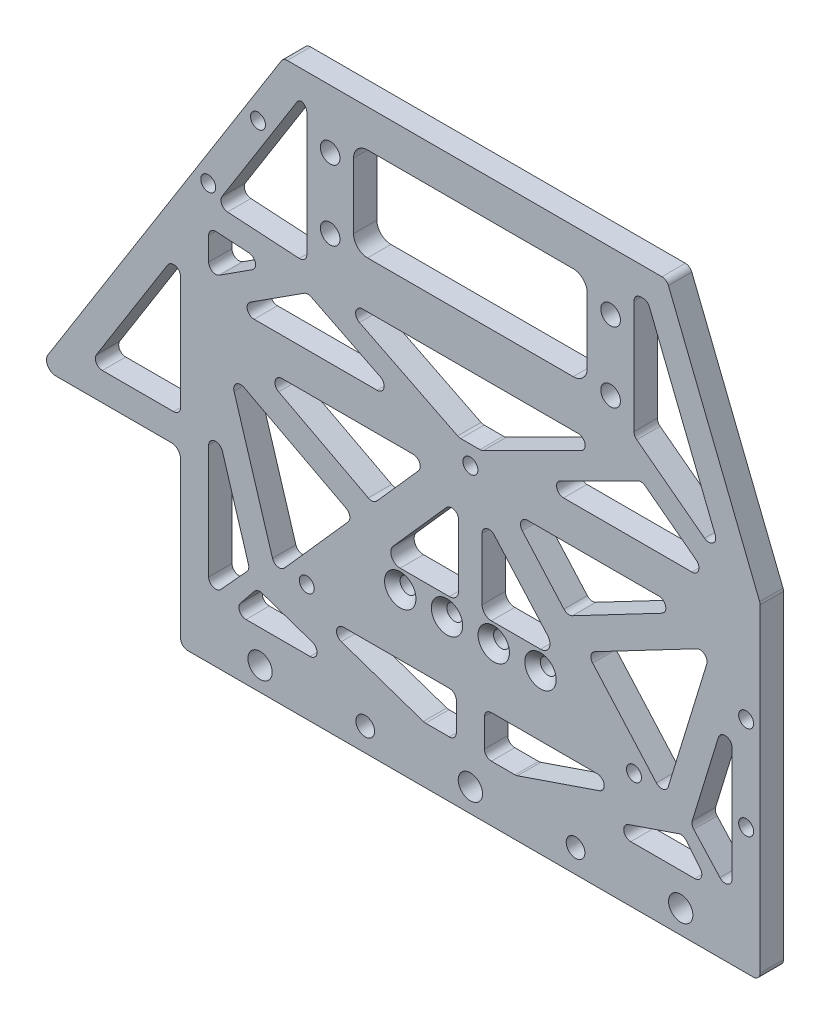
from build123d import *

# Parameters (mm, degrees)
SKETCH_1_W                   = 124
SKETCH_1_H                   = 120
EXTRUDE_1_DEPTH              = 5
SKETCH_2_R                   = 1.6
CUT_EXTRUDE_1_DEPTH          = 87.423376467
SKETCH_3_R                   = 1.6
CUT_EXTRUDE_2_DEPTH          = 87.423376467
SKETCH_4_R                   = 2.1
CUT_EXTRUDE_3_DEPTH          = 87.423376467
CHAMFER_1_SIZE               = 22
CHAMFER_1_SIZE2              = 35
CHAMFER_2_SIZE               = 50
CHAMFER_2_SIZE2              = 20
SKETCH_7_R                   = 2.6
CUT_EXTRUDE_4_DEPTH          = 87.423376467
SKETCH_8_R                   = 1.6
CUT_EXTRUDE_5_DEPTH          = 87.423376467
SKETCH_9_W                   = 50
SKETCH_9_H                   = 20
CUT_EXTRUDE_6_DEPTH          = 10
FILLET_2_R                   = 1.5
FILLET_3_R                   = 3
SKETCH_10_R                  = 2
CUT_EXTRUDE_7_DEPTH          = 10
EXTRUDE_2_DEPTH              = 5
FILLET_4_R                   = 2
SKETCH_12_R                  = 1.55
CUT_EXTRUDE_8_DEPTH          = 87.423376467
HOLE_WIZARD_M3_1_D           = 3.4
HOLE_WIZARD_M3_1_DEPTH       = 5
HOLE_WIZARD_M3_1_CSINK_D     = 6.72
HOLE_WIZARD_M3_1_CSINK_ANGLE = 90
EXTRUDE_3_DEPTH              = 5
FILLET_5_R                   = 2
CUT_EXTRUDE_9_DEPTH          = 10
FILLET_6_R                   = 1.5


with BuildPart() as part:
    # 草图1 → 凸台-拉伸1 (new body)
    with BuildSketch(Plane.XY):
        Rectangle(SKETCH_1_W, SKETCH_1_H)
    extrude(amount=EXTRUDE_1_DEPTH)

    # 草图2 → 切除-拉伸1 (cut, through all)
    with BuildSketch(Plane.XY.offset(5)):
        with Locations((-35, -35)):
            Circle(SKETCH_2_R)
        with Locations((35, -35)):
            Circle(SKETCH_2_R)
    extrude(amount=-CUT_EXTRUDE_1_DEPTH, mode=Mode.SUBTRACT)

    # 草图3 → 切除-拉伸2 (cut, through all)
    with BuildSketch(Plane.XY.offset(5)):
        with Locations((0, 4.5)):
            Circle(SKETCH_3_R)
    extrude(amount=-CUT_EXTRUDE_2_DEPTH, mode=Mode.SUBTRACT)

    # 草图4 → 切除-拉伸3 (cut, through all)
    with BuildSketch(Plane.XY.offset(5)):
        with Locations((-30, 47.5)):
            Circle(SKETCH_4_R)
        with Locations((30, 32.5)):
            Circle(SKETCH_4_R)
        with Locations((30, 47.5)):
            Circle(SKETCH_4_R)
        with Locations((-30, 32.5)):
            Circle(SKETCH_4_R)
    extrude(amount=-CUT_EXTRUDE_3_DEPTH, mode=Mode.SUBTRACT)

    # 倒角1
    chamfer_1_edges = [part.edges().sort_by_distance(p)[0] for p in [
        (-62, 60, 2.5),
    ]]
    chamfer_1_side = [part.faces().sort_by_distance(p)[0] for p in [
        (0, 60, 2.5),
    ]]
    chamfer(chamfer_1_edges, length=CHAMFER_1_SIZE, length2=CHAMFER_1_SIZE2, reference=chamfer_1_side[0])

    # 倒角2
    chamfer_2_edges = [part.edges().sort_by_distance(p)[0] for p in [
        (62, 60, 2.5),
    ]]
    chamfer_2_side = [part.faces().sort_by_distance(p)[0] for p in [
        (62, 0, 2.5),
    ]]
    chamfer(chamfer_2_edges, length=CHAMFER_2_SIZE, length2=CHAMFER_2_SIZE2, reference=chamfer_2_side[0])

    # 草图7 → 切除-拉伸4 (cut, through all)
    with BuildSketch(Plane.XY.offset(5)):
        with Locations((-45, -55)):
            Circle(SKETCH_7_R)
        with Locations((0, -55)):
            Circle(SKETCH_7_R)
        with Locations((45, -55)):
            Circle(SKETCH_7_R)
    extrude(amount=-CUT_EXTRUDE_4_DEPTH, mode=Mode.SUBTRACT)

    # 草图8 → 切除-拉伸5 (cut, through all)
    with BuildSketch(Plane(origin=(0, 0, 0), x_dir=(-1, 0, 0), z_dir=(0, 0, -1))):
        with Locations((-59, -33)):
            Circle(SKETCH_8_R)
        with Locations((-59, -13)):
            Circle(SKETCH_8_R)
        with Locations((45.442663531, 45.703937126)):
            Circle(SKETCH_8_R)
        with Locations((56.086094435, 28.771206142)):
            Circle(SKETCH_8_R)
    extrude(amount=-CUT_EXTRUDE_5_DEPTH, mode=Mode.SUBTRACT)

    # 草图9 → 切除-拉伸6 (cut)
    with BuildSketch(Plane.XY.offset(5)):
        Polygon((-20.795143669, -12.937322966), (-8.888654966, 0.5), (-46.405227211, 0.5), align=None)
        Polygon((46.405227211, 0.5), (8.888654966, 0.5), (20.795143669, -12.937322966), align=None)
        Polygon((36.651188431, 20.030509243), (13.590169944, 8.5), (51.861647432, 8.5), align=None)
        Polygon((-51.376856395, 8.5), (-13.590169944, 8.5), (-34.845181073, 19.127505564), align=None)
        Polygon((-2.409830056, 8.5), (2.409830056, 8.5), (29.409830056, 22), (-29.409830056, 22), align=None)
        with Locations((0, 42)):
            Rectangle(SKETCH_9_W, SKETCH_9_H)
        Polygon((56, -48), (56, -9.733809511), (47.224115046, -38.355523672), align=None)
        Polygon((-56, 20.766320607), (-56, 11.472020889), (-42.786156177, 19.966634775), align=None)
        Polygon((-47.224115046, -38.355523672), (-56, -9.733809511), (-56, -48), align=None)
        Polygon((-54.483388829, 25.683685076), (-35, 24.504573971), (-35, 54), (-36.684562306, 54), align=None)
        Polygon((-41.557478496, -36.369100842), (-24.893558667, -17.562677034), (-51.624213171, -3.53740308), align=None)
        Polygon((51.624213171, -3.53740308), (24.893558667, -17.562677034), (41.557478496, -36.369100842), align=None)
        Polygon((51.155461986, -48), (45.560495731, -41.070588478), (25.28565897, -48), align=None)
        Polygon((35, 27.556493075), (54.396821993, 12.852450597), (37.937802231, 54), (35, 54), align=None)
        Polygon((-25.28565897, -48), (-45.560495731, -41.070588478), (-51.155461986, -48), align=None)
        Polygon((9.825265002, -48), (36.158457982, -39), (3, -39), (3, -48), align=None)
        Polygon((-3, -39), (-36.158457982, -39), (-9.825265002, -48), (-3, -48), align=None)
        Polygon((2.5, -32), (28.333508776, -32), (2.5, -2.845040096), align=None)
        Polygon((-2.5, -32), (-2.5, -2.845040096), (-28.333508776, -32), align=None)
    extrude(amount=-CUT_EXTRUDE_6_DEPTH, mode=Mode.SUBTRACT)

    # 圆角2
    # the kernel refuses this fillet: 1.5 mm, written as the material it adds along each edge
    with BuildSketch(Plane(origin=(-20.795143669, -12.937322966, 5), x_dir=(-0.8855113060794975, 0.46461782876400964, 0), z_dir=(0, 0, -1))) as fillet_2_piece_1:
        with BuildLine():
            CenterArc((FILLET_2_R * 0.783284708727, FILLET_2_R), FILLET_2_R, 193.857889439, 76.142110561)
            Line((-FILLET_2_R * 0.187608070565, FILLET_2_R * 0.760485467833), (0, 0))
            Line((0, 0), (FILLET_2_R * 0.783284708727, 0))
        make_face()
    extrude(amount=5)
    with BuildSketch(Plane(origin=(-46.405227211, 0.5, 5), x_dir=(0.8855113060794989, -0.4646178287640068, 0), z_dir=(0, 0, -1))) as fillet_2_piece_2:
        with BuildLine():
            CenterArc((FILLET_2_R * 4.05819835002, -FILLET_2_R), FILLET_2_R, 90, 152.314508611)
            Line((FILLET_2_R * 3.59358052125, -FILLET_2_R * 1.88551130608), (0, 0))
            Line((0, 0), (FILLET_2_R * 4.05819835002, 0))
        make_face()
    extrude(amount=5)
    with BuildSketch(Plane(origin=(-8.888654966, 0.5, 5), x_dir=(-1, 0, 0), z_dir=(0, 0, -1)), Plane(origin=(-28.333508776, -32, 5), x_dir=(1, 0, 0), z_dir=(0, 0, -1)), Plane(origin=(28.333508776, -32, 5), x_dir=(-0.6631869212816371, 0.7484538111607045, 0), z_dir=(0, 0, -1)), Plane(origin=(8.888654966, 0.5, 5), x_dir=(0.663186921281637, -0.7484538111607046, 0), z_dir=(0, 0, -1))) as fillet_2_piece_3:
        with BuildLine():
            CenterArc((FILLET_2_R * 2.22216374141, -FILLET_2_R), FILLET_2_R, 90, 131.543380828)
            Line((FILLET_2_R * 1.47370993025, -FILLET_2_R * 1.66318692128), (0, 0))
            Line((0, 0), (FILLET_2_R * 2.22216374141, 0))
        make_face()
    extrude(amount=5)
    with BuildSketch(Plane(origin=(-47.224115046, -38.355523672, 5), x_dir=(-0.2931459684588604, 0.9560676969630952, 0), z_dir=(0, 0, -1)), Plane(origin=(47.224115046, -38.355523672, 5), x_dir=(0.673016151793855, -0.7396277843784607, 0), z_dir=(0, 0, -1))) as fillet_2_piece_4:
        with BuildLine():
            CenterArc((FILLET_2_R * 0.569773364902, -FILLET_2_R), FILLET_2_R, 90, 59.346676613)
            Line((-FILLET_2_R * 0.290494540513, -FILLET_2_R * 0.490157739185), (0, 0))
            Line((0, 0), (FILLET_2_R * 0.569773364902, 0))
        make_face()
    extrude(amount=5)
    with BuildSketch(Plane(origin=(-56, -48, 5), x_dir=(0.6730161517938523, 0.7396277843784631, 0), z_dir=(0, 0, -1)), Plane(origin=(56, -48, 5), x_dir=(0, 1, 0), z_dir=(0, 0, -1))) as fillet_2_piece_5:
        with BuildLine():
            CenterArc((FILLET_2_R * 2.58482323157, -FILLET_2_R), FILLET_2_R, 90, 137.699718158)
            Line((FILLET_2_R * 1.91180707978, -FILLET_2_R * 1.73962778438), (0, 0))
            Line((0, 0), (FILLET_2_R * 2.58482323157, 0))
        make_face()
    extrude(amount=5)
    with BuildSketch(Plane(origin=(-56, -9.733809511, 5), x_dir=(0.2931459684588615, -0.956067696963095, 0), z_dir=(0, 0, -1)), Plane(origin=(56, -9.733809511, 5), x_dir=(0, -1, 0), z_dir=(0, 0, -1))) as fillet_2_piece_6:
        with BuildLine():
            CenterArc((FILLET_2_R * 6.6726747335, FILLET_2_R), FILLET_2_R, 107.046394772, 162.953605228)
            Line((FILLET_2_R * 6.37952876504, FILLET_2_R * 1.95606769696), (0, 0))
            Line((0, 0), (FILLET_2_R * 6.6726747335, 0))
        make_face()
    extrude(amount=5)
    with BuildSketch(Plane(origin=(-2.5, -2.845040096, 5), x_dir=(-0.663186921281637, -0.7484538111607046, 0), z_dir=(0, 0, -1)), Plane(origin=(2.5, -2.845040096, 5), x_dir=(0, -1, 0), z_dir=(0, 0, -1))) as fillet_2_piece_7:
        with BuildLine():
            CenterArc((FILLET_2_R * 2.63644193673, -FILLET_2_R), FILLET_2_R, 90, 138.456619172)
            Line((FILLET_2_R * 1.97325501545, -FILLET_2_R * 1.74845381116), (0, 0))
            Line((0, 0), (FILLET_2_R * 2.63644193673, 0))
        make_face()
    extrude(amount=5)
    with BuildSketch(Plane(origin=(-2.5, -32, 5), x_dir=(-1, 0, 0), z_dir=(0, 0, -1)), Plane(origin=(2.5, -32, 5), x_dir=(0, 1, 0), z_dir=(0, 0, -1)), Plane(origin=(-3, -48, 5), x_dir=(-1, 0, 0), z_dir=(0, 0, -1))) as fillet_2_piece_8:
        with BuildLine():
            CenterArc((FILLET_2_R, FILLET_2_R), FILLET_2_R, 180, 90)
            Line((0, FILLET_2_R), (0, 0))
            Line((0, 0), (FILLET_2_R, 0))
        make_face()
    extrude(amount=5)
    with BuildSketch(Plane(origin=(3, -48, 5), x_dir=(1, 0, 0), z_dir=(0, 0, -1)), Plane(origin=(3, -39, 5), x_dir=(0, -1, 0), z_dir=(0, 0, -1)), Plane(origin=(-3, -39, 5), x_dir=(-1, 0, 0), z_dir=(0, 0, -1)), Plane(origin=(-35, 54, 5), x_dir=(-1, 0, 0), z_dir=(0, 0, -1)), Plane(origin=(35, 54, 5), x_dir=(0, -1, 0), z_dir=(0, 0, -1))) as fillet_2_piece_9:
        with BuildLine():
            CenterArc((FILLET_2_R, -FILLET_2_R), FILLET_2_R, 90, 90)
            Line((0, -FILLET_2_R), (0, 0))
            Line((0, 0), (FILLET_2_R, 0))
        make_face()
    extrude(amount=5)
    with BuildSketch(Plane(origin=(36.158457982, -39, 5), x_dir=(-0.946259952100711, -0.3234070238111103, 0), z_dir=(0, 0, -1))) as fillet_2_piece_10:
        with BuildLine():
            CenterArc((FILLET_2_R * 6.01798912456, FILLET_2_R), FILLET_2_R, 108.86909291, 161.13090709)
            Line((FILLET_2_R * 5.69458210075, FILLET_2_R * 1.9462599521), (0, 0))
            Line((0, 0), (FILLET_2_R * 6.01798912456, 0))
        make_face()
    extrude(amount=5)
    with BuildSketch(Plane(origin=(9.825265002, -48, 5), x_dir=(0.9462599521007252, 0.3234070238110687, 0), z_dir=(0, 0, -1)), Plane(origin=(-9.825265002, -48, 5), x_dir=(1, 0, 0), z_dir=(0, 0, -1))) as fillet_2_piece_11:
        with BuildLine():
            CenterArc((FILLET_2_R * 0.166168462472, -FILLET_2_R), FILLET_2_R, 90, 18.86909291)
            Line((-FILLET_2_R * 0.157238561339, -FILLET_2_R * 0.0537400478993), (0, 0))
            Line((0, 0), (FILLET_2_R * 0.166168462472, 0))
        make_face()
    extrude(amount=5)
    with BuildSketch(Plane(origin=(25.28565897, -48, 5), x_dir=(1, 0, 0), z_dir=(0, 0, -1)), Plane(origin=(-36.158457982, -39, 5), x_dir=(0.946259952100711, -0.3234070238111103, 0), z_dir=(0, 0, -1)), Plane(origin=(-25.28565897, -48, 5), x_dir=(-0.9462599521007113, 0.32340702381110964, 0), z_dir=(0, 0, -1))) as fillet_2_piece_12:
        with BuildLine():
            CenterArc((FILLET_2_R * 6.01798912456, -FILLET_2_R), FILLET_2_R, 90, 161.13090709)
            Line((FILLET_2_R * 5.69458210075, -FILLET_2_R * 1.9462599521), (0, 0))
            Line((0, 0), (FILLET_2_R * 6.01798912456, 0))
        make_face()
    extrude(amount=5)
    with BuildSketch(Plane(origin=(45.560495731, -41.070588478, 5), x_dir=(0.6282102919478427, -0.7780435907394947, 0), z_dir=(0, 0, -1)), Plane(origin=(-45.560495731, -41.070588478, 5), x_dir=(0.9462599521007107, -0.3234070238111115, 0), z_dir=(0, 0, -1))) as fillet_2_piece_13:
        with BuildLine():
            CenterArc((FILLET_2_R * 0.699569025654, FILLET_2_R), FILLET_2_R, 200.049111296, 69.950888704)
            Line((-FILLET_2_R * 0.239830086098, FILLET_2_R * 0.657174521309), (0, 0))
            Line((0, 0), (FILLET_2_R * 0.699569025654, 0))
        make_face()
    extrude(amount=5)
    with BuildSketch(Plane(origin=(51.155461986, -48, 5), x_dir=(-0.6282102919478418, 0.7780435907394954, 0), z_dir=(0, 0, -1)), Plane(origin=(-51.155461986, -48, 5), x_dir=(1, 0, 0), z_dir=(0, 0, -1))) as fillet_2_piece_14:
        with BuildLine():
            CenterArc((FILLET_2_R * 2.09269803302, -FILLET_2_R), FILLET_2_R, 90, 128.918204205)
            Line((FILLET_2_R * 1.31465444228, -FILLET_2_R * 1.62821029195), (0, 0))
            Line((0, 0), (FILLET_2_R * 2.09269803302, 0))
        make_face()
    extrude(amount=5)
    with BuildSketch(Plane(origin=(46.405227211, 0.5, 5), x_dir=(-0.8855113060794988, -0.46461782876400726, 0), z_dir=(0, 0, -1))) as fillet_2_piece_15:
        with BuildLine():
            CenterArc((FILLET_2_R * 4.05819835002, FILLET_2_R), FILLET_2_R, 117.685491389, 152.314508611)
            Line((FILLET_2_R * 3.59358052125, FILLET_2_R * 1.88551130608), (0, 0))
            Line((0, 0), (FILLET_2_R * 4.05819835002, 0))
        make_face()
    extrude(amount=5)
    with BuildSketch(Plane(origin=(20.795143669, -12.937322966, 5), x_dir=(0.8855113060794993, 0.46461782876400604, 0), z_dir=(0, 0, -1))) as fillet_2_piece_16:
        with BuildLine():
            CenterArc((FILLET_2_R * 0.783284708727, -FILLET_2_R), FILLET_2_R, 90, 76.142110561)
            Line((-FILLET_2_R * 0.187608070565, -FILLET_2_R * 0.760485467833), (0, 0))
            Line((0, 0), (FILLET_2_R * 0.783284708727, 0))
        make_face()
    extrude(amount=5)
    with BuildSketch(Plane(origin=(-35, 24.504573971, 5), x_dir=(0, 1, 0), z_dir=(0, 0, -1)), Plane(origin=(-56, 20.766320607, 5), x_dir=(0, -1, 0), z_dir=(0, 0, -1))) as fillet_2_piece_17:
        with BuildLine():
            CenterArc((FILLET_2_R * 1.06234837763, -FILLET_2_R), FILLET_2_R, 90, 93.463247259)
            Line((FILLET_2_R * 0.064174624583, -FILLET_2_R * 1.06040826713), (0, 0))
            Line((0, 0), (FILLET_2_R * 1.06234837763, 0))
        make_face()
    extrude(amount=5)
    with BuildSketch(Plane(origin=(-54.483388829, 25.683685076, 5), x_dir=(0.5321715452183424, 0.846636549211007, 0), z_dir=(0, 0, -1))) as fillet_2_piece_18:
        with BuildLine():
            CenterArc((FILLET_2_R * 1.68717716114, FILLET_2_R), FILLET_2_R, 151.310952118, 118.689047882)
            Line((FILLET_2_R * 0.809939218483, FILLET_2_R * 1.48005582172), (0, 0))
            Line((0, 0), (FILLET_2_R * 1.68717716114, 0))
        make_face()
    extrude(amount=5)
    with BuildSketch(Plane(origin=(-36.684562306, 54, 5), x_dir=(-0.5321715452183408, -0.8466365492110081, 0), z_dir=(0, 0, -1))) as fillet_2_piece_19:
        with BuildLine():
            CenterArc((FILLET_2_R * 0.552572949063, -FILLET_2_R), FILLET_2_R, 90, 57.847704859)
            Line((-FILLET_2_R * 0.294063600148, -FILLET_2_R * 0.467828454782), (0, 0))
            Line((0, 0), (FILLET_2_R * 0.552572949063, 0))
        make_face()
    extrude(amount=5)
    with BuildSketch(Plane(origin=(-42.786156177, 19.966634775, 5), x_dir=(-0.9981737530420696, 0.060408267132153484, 0), z_dir=(0, 0, -1))) as fillet_2_piece_20:
        with BuildLine():
            CenterArc((FILLET_2_R * 3.05964186518, -FILLET_2_R), FILLET_2_R, 90, 143.801526468)
            Line((FILLET_2_R * 2.46905769673, -FILLET_2_R * 1.80697604672), (0, 0))
            Line((0, 0), (FILLET_2_R * 3.05964186518, 0))
        make_face()
    extrude(amount=5)
    with BuildSketch(Plane(origin=(-56, 11.472020889, 5), x_dir=(0, 1, 0), z_dir=(0, 0, -1))) as fillet_2_piece_21:
        with BuildLine():
            CenterArc((FILLET_2_R * 1.83166549836, FILLET_2_R), FILLET_2_R, 147.264773728, 122.735226272)
            Line((FILLET_2_R * 0.990487022987, FILLET_2_R * 1.54075759131), (0, 0))
            Line((0, 0), (FILLET_2_R * 1.83166549836, 0))
        make_face()
    extrude(amount=5)
    with BuildSketch(Plane(origin=(-29.409830056, 22, 5), x_dir=(0.8944271909999193, -0.447213595499951, 0), z_dir=(0, 0, -1)), Plane(origin=(29.409830056, 22, 5), x_dir=(-1, 0, 0), z_dir=(0, 0, -1))) as fillet_2_piece_22:
        with BuildLine():
            CenterArc((FILLET_2_R * 4.2360679775, -FILLET_2_R), FILLET_2_R, 90, 153.434948823)
            Line((FILLET_2_R * 3.788854382, -FILLET_2_R * 1.894427191), (0, 0))
            Line((0, 0), (FILLET_2_R * 4.2360679775, 0))
        make_face()
    extrude(amount=5)
    with BuildSketch(Plane(origin=(2.409830056, 8.5, 5), x_dir=(0.8944271909999179, 0.4472135954999539, 0), z_dir=(0, 0, -1))) as fillet_2_piece_23:
        with BuildLine():
            CenterArc((FILLET_2_R * 0.2360679775, -FILLET_2_R), FILLET_2_R, 90, 26.565051177)
            Line((-FILLET_2_R * 0.211145618, -FILLET_2_R * 0.105572809), (0, 0))
            Line((0, 0), (FILLET_2_R * 0.2360679775, 0))
        make_face()
    extrude(amount=5)
    with BuildSketch(Plane(origin=(-2.409830056, 8.5, 5), x_dir=(-0.8944271909999199, 0.4472135954999499, 0), z_dir=(0, 0, -1))) as fillet_2_piece_24:
        with BuildLine():
            CenterArc((FILLET_2_R * 0.2360679775, FILLET_2_R), FILLET_2_R, 243.434948823, 26.565051177)
            Line((-FILLET_2_R * 0.211145618, FILLET_2_R * 0.105572809), (0, 0))
            Line((0, 0), (FILLET_2_R * 0.2360679775, 0))
        make_face()
    extrude(amount=5)
    with BuildSketch(Plane(origin=(13.590169944, 8.5, 5), x_dir=(0.8944271909999199, 0.44721359549995016, 0), z_dir=(0, 0, -1)), Plane(origin=(-13.590169944, 8.5, 5), x_dir=(-1, 0, 0), z_dir=(0, 0, -1))) as fillet_2_piece_25:
        with BuildLine():
            CenterArc((FILLET_2_R * 4.2360679775, FILLET_2_R), FILLET_2_R, 116.565051177, 153.434948823)
            Line((FILLET_2_R * 3.788854382, FILLET_2_R * 1.894427191), (0, 0))
            Line((0, 0), (FILLET_2_R * 4.2360679775, 0))
        make_face()
    extrude(amount=5)
    with BuildSketch(Plane(origin=(36.651188431, 20.030509243, 5), x_dir=(-0.8944271909999189, -0.4472135954999518, 0), z_dir=(0, 0, -1))) as fillet_2_piece_26:
        with BuildLine():
            CenterArc((FILLET_2_R * 0.62159223034, -FILLET_2_R), FILLET_2_R, 90, 63.729526071)
            Line((-FILLET_2_R * 0.27512240761, -FILLET_2_R * 0.557390851781), (0, 0))
            Line((0, 0), (FILLET_2_R * 0.62159223034, 0))
        make_face()
    extrude(amount=5)
    with BuildSketch(Plane(origin=(51.861647432, 8.5, 5), x_dir=(-0.7969046345270256, 0.6041051261737046, 0), z_dir=(0, 0, -1))) as fillet_2_piece_27:
        with BuildLine():
            CenterArc((FILLET_2_R * 2.97448996321, -FILLET_2_R), FILLET_2_R, 90, 142.835525106)
            Line((FILLET_2_R * 2.37038483704, -FILLET_2_R * 1.79690463453), (0, 0))
            Line((0, 0), (FILLET_2_R * 2.97448996321, 0))
        make_face()
    extrude(amount=5)
    with BuildSketch(Plane(origin=(-34.845181073, 19.127505564, 5), x_dir=(-0.8411784753765612, -0.540757591313487, 0), z_dir=(0, 0, -1))) as fillet_2_piece_28:
        with BuildLine():
            CenterArc((FILLET_2_R * 0.569237129121, -FILLET_2_R), FILLET_2_R, 90, 59.300277449)
            Line((-FILLET_2_R * 0.29061761472, -FILLET_2_R * 0.489461245845), (0, 0))
            Line((0, 0), (FILLET_2_R * 0.569237129121, 0))
        make_face()
    extrude(amount=5)
    with BuildSketch(Plane(origin=(-51.376856395, 8.5, 5), x_dir=(1, 0, 0), z_dir=(0, 0, -1))) as fillet_2_piece_29:
        with BuildLine():
            CenterArc((FILLET_2_R * 3.40481299745, -FILLET_2_R), FILLET_2_R, 90, 147.264773728)
            Line((FILLET_2_R * 2.86405540614, -FILLET_2_R * 1.84117847538), (0, 0))
            Line((0, 0), (FILLET_2_R * 3.40481299745, 0))
        make_face()
    extrude(amount=5)
    with BuildSketch(Plane(origin=(-51.624213171, -3.53740308, 5), x_dir=(0.29314596845886026, -0.9560676969630952, 0), z_dir=(0, 0, -1)), Plane(origin=(51.624213171, -3.53740308, 5), x_dir=(-0.8855113060794988, -0.464617828764007, 0), z_dir=(0, 0, -1))) as fillet_2_piece_30:
        with BuildLine():
            CenterArc((FILLET_2_R * 2.39832656555, -FILLET_2_R), FILLET_2_R, 90, 134.731886161)
            Line((FILLET_2_R * 1.68791865389, -FILLET_2_R * 1.70379016692), (0, 0))
            Line((0, 0), (FILLET_2_R * 2.39832656555, 0))
        make_face()
    extrude(amount=5)
    with BuildSketch(Plane(origin=(-24.893558667, -17.562677034, 5), x_dir=(-0.6631869212816379, -0.748453811160704, 0), z_dir=(0, 0, -1)), Plane(origin=(24.893558667, -17.562677034, 5), x_dir=(0.8855113060794996, 0.46461782876400576, 0), z_dir=(0, 0, -1))) as fillet_2_piece_31:
        with BuildLine():
            CenterArc((FILLET_2_R * 1.27667499296, FILLET_2_R), FILLET_2_R, 166.142110561, 103.857889439)
            Line((FILLET_2_R * 0.305782213669, FILLET_2_R * 1.23951453217), (0, 0))
            Line((0, 0), (FILLET_2_R * 1.27667499296, 0))
        make_face()
    extrude(amount=5)
    with BuildSketch(Plane(origin=(-41.557478496, -36.369100842, 5), x_dir=(0.6631869212816383, 0.7484538111607038, 0), z_dir=(0, 0, -1)), Plane(origin=(41.557478496, -36.369100842, 5), x_dir=(0.29314596845886154, 0.9560676969630948, 0), z_dir=(0, 0, -1))) as fillet_2_piece_32:
        with BuildLine():
            CenterArc((FILLET_2_R * 1.78235165433, -FILLET_2_R), FILLET_2_R, 90, 121.4102244)
            Line((FILLET_2_R * 0.92889384453, -FILLET_2_R * 1.52116193921), (0, 0))
            Line((0, 0), (FILLET_2_R * 1.78235165433, 0))
        make_face()
    extrude(amount=5)
    with BuildSketch(Plane(origin=(35, 27.556493075, 5), x_dir=(0.7969046345270255, -0.6041051261737048, 0), z_dir=(0, 0, -1))) as fillet_2_piece_33:
        with BuildLine():
            CenterArc((FILLET_2_R * 0.496790778562, -FILLET_2_R), FILLET_2_R, 90, 52.835525106)
            Line((-FILLET_2_R * 0.300113855965, -FILLET_2_R * 0.395894873826), (0, 0))
            Line((0, 0), (FILLET_2_R * 0.496790778562, 0))
        make_face()
    extrude(amount=5)
    with BuildSketch(Plane(origin=(37.937802231, 54, 5), x_dir=(0.3713906763541013, -0.9284766908852602, 0), z_dir=(0, 0, -1))) as fillet_2_piece_34:
        with BuildLine():
            CenterArc((FILLET_2_R * 0.677032961427, FILLET_2_R), FILLET_2_R, 201.801409486, 68.198590514)
            Line((-FILLET_2_R * 0.251443729458, FILLET_2_R * 0.628609323646), (0, 0))
            Line((0, 0), (FILLET_2_R * 0.677032961427, 0))
        make_face()
    extrude(amount=5)
    with BuildSketch(Plane(origin=(54.396821993, 12.852450597, 5), x_dir=(-0.3713906763541008, 0.9284766908852605, 0), z_dir=(0, 0, -1))) as fillet_2_piece_35:
        with BuildLine():
            CenterArc((FILLET_2_R * 3.6017192565, -FILLET_2_R), FILLET_2_R, 90, 148.96588438)
            Line((FILLET_2_R * 3.08617088988, -FILLET_2_R * 1.8568604797), (0, 0))
            Line((0, 0), (FILLET_2_R * 3.6017192565, 0))
        make_face()
    extrude(amount=5)
    # the kernel refuses this fillet: 1.5 mm, written as the material it takes off along each edge
    with BuildSketch(Plane(origin=(-40, 60, -2.072148559), x_dir=(1, 0, 0), z_dir=(0, 0, 1))) as fillet_2_2_piece_1:
        with BuildLine():
            CenterArc((FILLET_2_R * 0.552572949063, -FILLET_2_R), FILLET_2_R, 90, 57.847704859)
            Line((-FILLET_2_R * 0.294063600148, -FILLET_2_R * 0.467828454782), (0, 0))
            Line((0, 0), (FILLET_2_R * 0.552572949063, 0))
        make_face()
    extrude(amount=9.144297118, mode=Mode.SUBTRACT)
    with BuildSketch(Plane(origin=(42, 60, -2.538873605), x_dir=(-1, 0, 0), z_dir=(0, 0, 1))) as fillet_2_2_piece_2:
        with BuildLine():
            CenterArc((FILLET_2_R * 0.677032961427, FILLET_2_R), FILLET_2_R, 201.801409486, 68.198590514)
            Line((-FILLET_2_R * 0.251443729458, FILLET_2_R * 0.628609323646), (0, 0))
            Line((0, 0), (FILLET_2_R * 0.677032961427, 0))
        make_face()
    extrude(amount=10.077747211, mode=Mode.SUBTRACT)
    with BuildSketch(Plane(origin=(62, 10, -0.722184013), x_dir=(-0.3713906763541143, 0.9284766908852551, 0), z_dir=(0, 0, 1))) as fillet_2_2_piece_3:
        with BuildLine():
            CenterArc((FILLET_2_R * 0.192582403567, FILLET_2_R), FILLET_2_R, 248.198590514, 21.801409486)
            Line((-FILLET_2_R * 0.178808272787, FILLET_2_R * 0.0715233091147), (0, 0))
            Line((0, 0), (FILLET_2_R * 0.192582403567, 0))
        make_face()
    extrude(amount=6.444368027, mode=Mode.SUBTRACT)
    with BuildSketch(Plane(origin=(62, -60, -3.75), x_dir=(0, 1, 0), z_dir=(0, 0, 1))) as fillet_2_2_piece_4:
        with BuildLine():
            CenterArc((FILLET_2_R, FILLET_2_R), FILLET_2_R, 180, 90)
            Line((0, FILLET_2_R), (0, 0))
            Line((0, 0), (FILLET_2_R, 0))
        make_face()
    extrude(amount=12.5, mode=Mode.SUBTRACT)
    with BuildSketch(Plane(origin=(-62, -60, -3.75), x_dir=(0, 1, 0), z_dir=(0, 0, 1))) as fillet_2_2_piece_5:
        with BuildLine():
            CenterArc((FILLET_2_R, -FILLET_2_R), FILLET_2_R, 90, 90)
            Line((0, -FILLET_2_R), (0, 0))
            Line((0, 0), (FILLET_2_R, 0))
        make_face()
    extrude(amount=12.5, mode=Mode.SUBTRACT)

    # 圆角3
    fillet_3_edges = [part.edges().sort_by_distance(p)[0] for p in [
        (-25, 52, 2.5),
        (25, 52, 2.5),
        (25, 32, 2.5),
        (-25, 32, 2.5),
    ]]
    fillet(fillet_3_edges, radius=FILLET_3_R)

    # 草图10 → 切除-拉伸7 (cut)
    with BuildSketch(Plane.XY.offset(5)):
        with Locations((-22.5, -55)):
            Circle(SKETCH_10_R)
        with Locations((22.5, -55)):
            Circle(SKETCH_10_R)
    extrude(amount=-CUT_EXTRUDE_7_DEPTH, mode=Mode.SUBTRACT)

    # 草图11 → 凸台-拉伸2 (add)
    with BuildSketch(Plane.XY.offset(5)):
        with BuildLine():
            Line((-2.5, -22), (-19.472749282, -22))
            Line((-19.472749282, -22), (-26.12294388, -29.505219618))
            ThreePointArc((-26.12294388, -29.505219618), (-26.368139359, -31.115560487), (-25.000263164, -32))
            Line((-25.000263164, -32), (-4, -32))
            ThreePointArc((-4, -32), (-2.939339828, -31.560660172), (-2.5, -30.5))
            Line((-2.5, -30.5), (-2.5, -22))
        make_face()
        with BuildLine():
            Line((19.472749282, -22), (2.5, -22))
            Line((2.5, -22), (2.5, -30.5))
            ThreePointArc((2.5, -30.5), (2.939339828, -31.560660172), (4, -32))
            Line((4, -32), (25.000263164, -32))
            ThreePointArc((25.000263164, -32), (26.368139359, -31.115560487), (26.12294388, -29.505219618))
            Line((26.12294388, -29.505219618), (19.472749282, -22))
        make_face()
    extrude(amount=-EXTRUDE_2_DEPTH)

    # 圆角4
    fillet_4_edges = [part.edges().sort_by_distance(p)[0] for p in [
        (-19.472749282, -22, 2.5),
        (-2.5, -22, 2.5),
        (2.5, -22, 2.5),
        (19.472749282, -22, 2.5),
    ]]
    fillet(fillet_4_edges, radius=FILLET_4_R)

    # 草图12 → 切除-拉伸8 (cut, through all)
    with BuildSketch(Plane.XY.offset(5)):
        with Locations((-15, -26)):
            Circle(SKETCH_12_R)
        with Locations((-5, -26)):
            Circle(SKETCH_12_R)
        with Locations((5, -26)):
            Circle(SKETCH_12_R)
        with Locations((15, -26)):
            Circle(SKETCH_12_R)
    extrude(amount=-CUT_EXTRUDE_8_DEPTH, mode=Mode.SUBTRACT)

    # M3 六角凹锥坑螺钉的锥形沉头孔1
    with Locations(Plane.XY.offset(5)):
        with Locations((-15, -26), (-5, -26), (5, -26), (15, -26)):
            CounterSinkHole(HOLE_WIZARD_M3_1_D / 2, HOLE_WIZARD_M3_1_CSINK_D / 2, depth=HOLE_WIZARD_M3_1_DEPTH, counter_sink_angle=HOLE_WIZARD_M3_1_CSINK_ANGLE)

    # 草图15 → 凸台-拉伸3 (add)
    with BuildSketch(Plane.XY.offset(5)):
        Polygon((-62, 25), (-92.315241854, -23.228793858), (-62, -23.228793858), align=None)
    extrude(amount=-EXTRUDE_3_DEPTH)

    # 圆角5
    fillet_5_edges = [part.edges().sort_by_distance(p)[0] for p in [
        (-62, -23.228793858, 2.5),
        (-92.315241854, -23.228793858, 2.5),
    ]]
    fillet(fillet_5_edges, radius=FILLET_5_R)

    # 草图16 → 切除-拉伸9 (cut)
    with BuildSketch(Plane.XY.offset(5)):
        Polygon((-62, 13.725440032), (-81.456947016, -17.228793858), (-62, -17.228793858), align=None)
    extrude(amount=-CUT_EXTRUDE_9_DEPTH, mode=Mode.SUBTRACT)

    # 圆角6
    fillet_6_edges = [part.edges().sort_by_distance(p)[0] for p in [
        (-62, 13.725440032, 2.5),
        (-62, -17.228793858, 2.5),
        (-81.456947016, -17.228793858, 2.5),
    ]]
    fillet(fillet_6_edges, radius=FILLET_6_R)


solid = part.part
